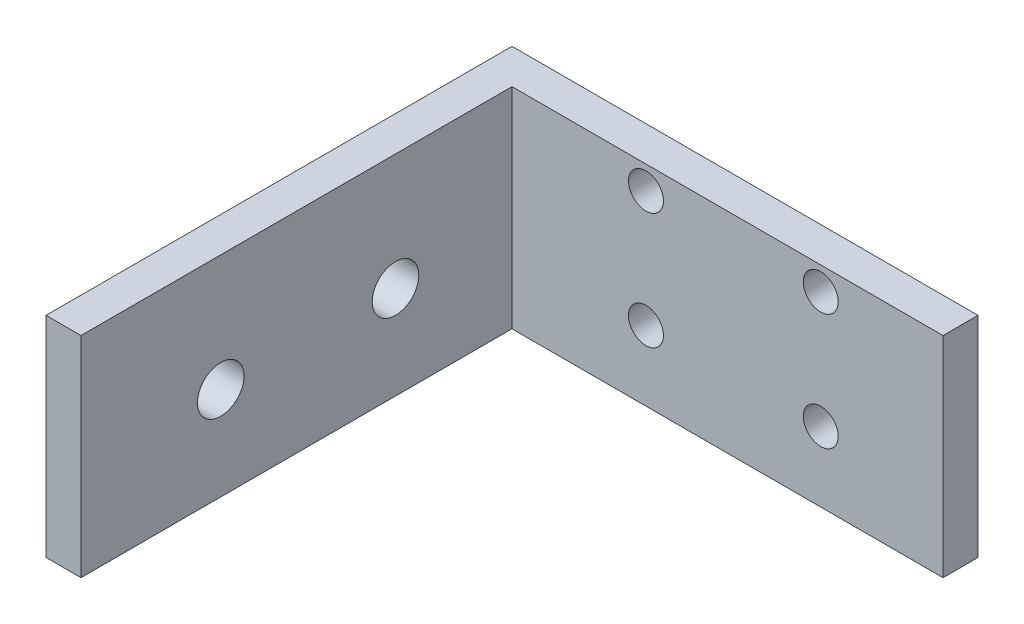
from build123d import *

# Parameters (mm, degrees)
ESQUISSE1_W             = 40
ESQUISSE1_H             = 18
BOSS_EXTRU_1_DEPTH      = 3
ESQUISSE2_W             = 3
ESQUISSE2_H             = 18
BOSS_EXTRU_2_DEPTH      = 37
ESQUISSE3_R             = 1.5
ENL_V_MAT_EXTRU_1_DEPTH = 58.384666942
ESQUISSE4_R             = 2
ENL_V_MAT_EXTRU_2_DEPTH = 58.384666942


with BuildPart() as part:
    # Esquisse1 → Boss.-Extru.1 (new body)
    with BuildSketch(Plane.XY):
        with Locations((20, 9)):
            Rectangle(ESQUISSE1_W, ESQUISSE1_H)
    extrude(amount=BOSS_EXTRU_1_DEPTH)

    # Esquisse2 → Boss.-Extru.2 (add)
    with BuildSketch(Plane.XY.offset(3)):
        with Locations((1.5, 9)):
            Rectangle(ESQUISSE2_W, ESQUISSE2_H)
    extrude(amount=BOSS_EXTRU_2_DEPTH)

    # Esquisse3 → Enlèv. mat.-Extru.1 (cut, through all)
    with BuildSketch(Plane.XY.offset(3)):
        with Locations((14.5, 16)):
            Circle(ESQUISSE3_R)
        with Locations((29.5, 16)):
            Circle(ESQUISSE3_R)
        with Locations((14.5, 6)):
            Circle(ESQUISSE3_R)
        with Locations((29.5, 6)):
            Circle(ESQUISSE3_R)
    extrude(amount=-ENL_V_MAT_EXTRU_1_DEPTH, mode=Mode.SUBTRACT)

    # Esquisse4 → Enlèv. mat.-Extru.2 (cut, through all)
    with BuildSketch(Plane(origin=(3, 0, 0), x_dir=(0, 0, -1), z_dir=(1, 0, 0))):
        with Locations((-28, 8)):
            Circle(ESQUISSE4_R)
        with Locations((-13, 8)):
            Circle(ESQUISSE4_R)
    extrude(amount=-ENL_V_MAT_EXTRU_2_DEPTH, mode=Mode.SUBTRACT)


solid = part.part
